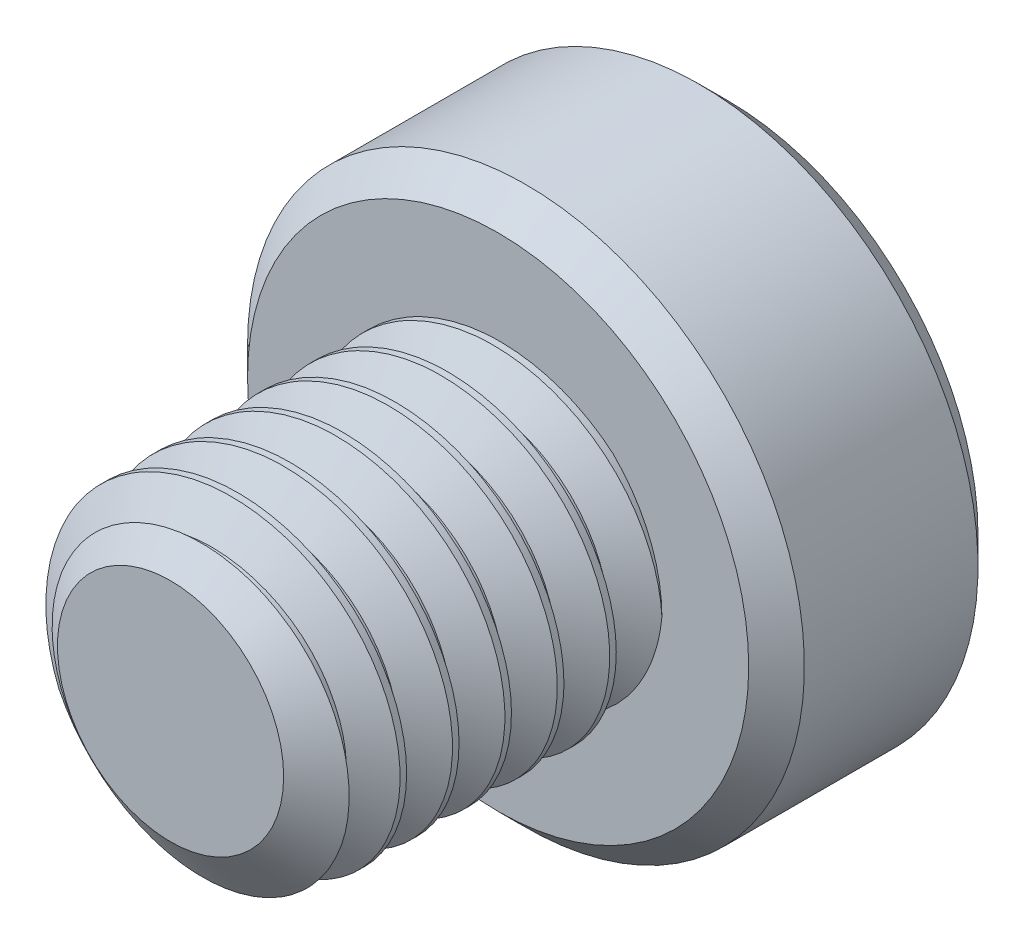
from build123d import *

# Parameters (mm, degrees)
SKETCH1_R          = 2.5
EXTRUDE1_DEPTH     = 5
CUT_SWEEP1_PITCH   = 0.8
SKETCH6_R          = 4.25
EXTRUDE2_DEPTH     = 3.5
CUT_EXTRUDE1_DEPTH = 2.25
CHAMFER1_SIZE      = 0.425


with BuildPart() as part:
    # Sketch1 → Extrude1 (new body)
    with BuildSketch(Plane.XY):
        Circle(SKETCH1_R)
    extrude(amount=-EXTRUDE1_DEPTH)

    # Cut-Sweep1: the profile of Sketch3 profile screwed along a right-hand helix of 7.25 turns, 6 arcs to a turn; built about Z, then put on its axis
    cut_sweep1_z = Axis((0, 0, 0), (0, 0, 1))
    cut_sweep1_corners = [(2.5003, 0, -0.700173205), (1.980384758, 0, -0.4), (1.980384758, 0, -0.3), (2.5003, 0, 0.000173205)]
    with BuildLine(mode=Mode.PRIVATE) as cut_sweep1_profile:
        Line(cut_sweep1_corners[0], cut_sweep1_corners[1])
        Line(cut_sweep1_corners[1], cut_sweep1_corners[2])
        Line(cut_sweep1_corners[2], cut_sweep1_corners[3])
        Line(cut_sweep1_corners[3], cut_sweep1_corners[0])
    cut_sweep1_cap = Face(cut_sweep1_profile.wire())
    cut_sweep1_turn_angles = [0, 30, 60, 90, 120, 150, 180, 210, 240, 270, 300, 330, 360]
    cut_sweep1_turn_weights = [1, 0.8660254037844387, 1, 0.8660254037844387, 1, 0.8660254037844387, 1, 0.8660254037844387, 1, 0.8660254037844387, 1, 0.8660254037844387, 1]
    cut_sweep1_turn_rails = [Edge.make_bspline([Vector(p[0], p[1], 0).rotate(cut_sweep1_z, cut_sweep1_turn_angles[k]) / cut_sweep1_turn_weights[k] + Vector(0, 0, p[2] + CUT_SWEEP1_PITCH * cut_sweep1_turn_angles[k] / 360) for k in range(13)], [0, 0, 0, 1, 1, 2, 2, 3, 3, 4, 4, 5, 5, 6, 6, 6], 2, cut_sweep1_turn_weights) for p in cut_sweep1_corners]
    cut_sweep1_turn_sides = [Face.make_surface_from_curves(cut_sweep1_turn_rails[p[0]], cut_sweep1_turn_rails[p[1]]) for p in [(0, 1), (1, 2), (2, 3), (3, 0)]]
    cut_sweep1_last_angles = [2520, 2550, 2580, 2595, 2610]
    cut_sweep1_last_weights = [1, 0.8660254037844387, 1, 0.9659258262890744, 1]
    cut_sweep1_last_rails = [Edge.make_bspline([Vector(p[0], p[1], 0).rotate(cut_sweep1_z, cut_sweep1_last_angles[k]) / cut_sweep1_last_weights[k] + Vector(0, 0, p[2] + CUT_SWEEP1_PITCH * cut_sweep1_last_angles[k] / 360) for k in range(5)], [0, 0, 0, 1, 1, 2, 2, 2], 2, cut_sweep1_last_weights) for p in cut_sweep1_corners]
    cut_sweep1_last_sides = [Face.make_surface_from_curves(cut_sweep1_last_rails[p[0]], cut_sweep1_last_rails[p[1]]) for p in [(0, 1), (1, 2), (2, 3), (3, 0)]]
    cut_sweep1 = Plane(origin=(0, 0, 0), x_dir=(0, 1, 0), z_dir=(0, 0, -1)) * Solid(Shell([*[p.moved(Location((0, 0, CUT_SWEEP1_PITCH * i))) for i in range(7) for p in cut_sweep1_turn_sides], *cut_sweep1_last_sides, cut_sweep1_cap, cut_sweep1_cap.rotate(cut_sweep1_z, 2610).moved(Location((0, 0, CUT_SWEEP1_PITCH * 2610 / 360)))]))
    add(cut_sweep1, mode=Mode.SUBTRACT)

    # Sketch4 → Cut-Revolve1 (revolve, cut)
    with BuildSketch(Plane(origin=(0, 0, 0), x_dir=(0, 0, -1), z_dir=(1, 0, 0)), mode=Mode.PRIVATE) as cut_revolve1_sk:
        Polygon((0.541691224, 2.5), (0, 1.726384758), (0, 2.5), align=None)
    revolve(cut_revolve1_sk.sketch.rotate(Axis((0, 0, 0), (0, 0, -1)), 260.43858876), axis=Axis((0, 0, 0), (0, 0, -1)), mode=Mode.SUBTRACT)

    # Sketch6 → Extrude2 (add)
    with BuildSketch(Plane(origin=(0, 0, -5), x_dir=(-1, 0, 0), z_dir=(0, 0, -1))):
        Circle(SKETCH6_R)
    extrude(amount=EXTRUDE2_DEPTH)

    # Sketch7 → Cut-Extrude1 (cut)
    with BuildSketch(Plane(origin=(0, 0, -8.5), x_dir=(-1, 0, 0), z_dir=(0, 0, -1))):
        Polygon((0, 1.732050808), (-1.5, 0.866025404), (-1.5, -0.866025404), (0, -1.732050808), (1.5, -0.866025404), (1.5, 0.866025404), align=None)
    extrude(amount=-CUT_EXTRUDE1_DEPTH, mode=Mode.SUBTRACT)

    # Cut-Extrude2 cone 1 section (through the dimple's axis) → Cut-Extrude2 (revolve, cut)
    with BuildSketch(Plane(origin=(0, 0, -8.5), x_dir=(0, 1, 0), z_dir=(1, 0, 0))):
        Polygon((0, 0), (1.732050808, 0), (0, 1.732050808), align=None)
    revolve(axis=Axis((0, 0, -8.5), (0, 0, 1)), mode=Mode.SUBTRACT)

    # Chamfer1
    chamfer1_edges = [part.edges().sort_by_distance(p)[0] for p in [
        (4.25, 0, -5),
        (4.25, 0, -8.5),
    ]]
    chamfer(chamfer1_edges, length=CHAMFER1_SIZE)


solid = part.part
